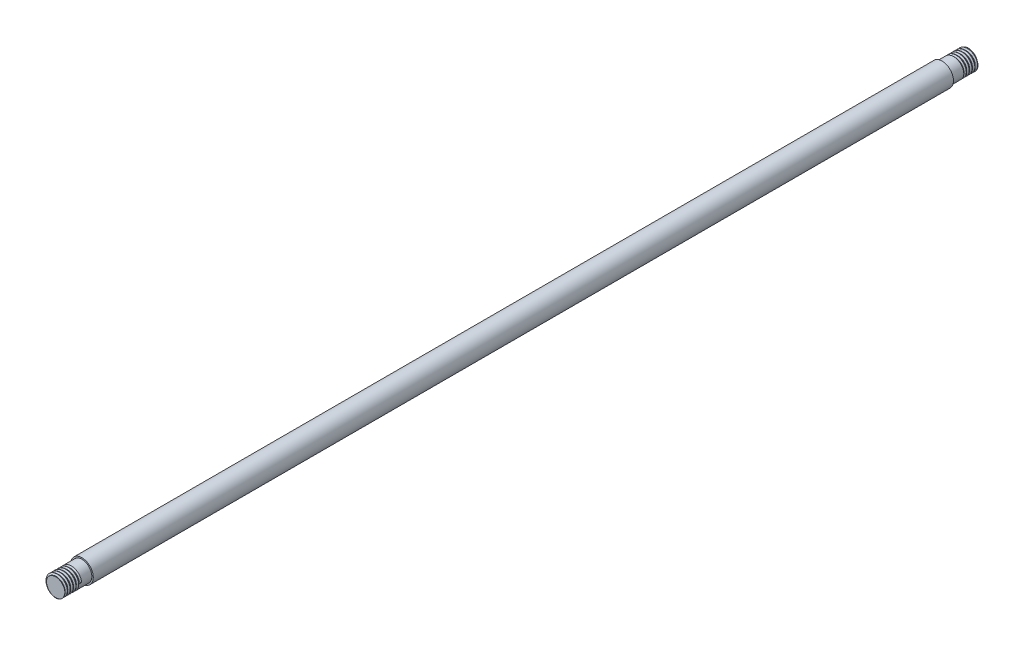
from build123d import *

# Parameters (mm, degrees)
THREAD1_PITCH = 2
THREAD2_PITCH = 2


with BuildPart() as part:
    # Sketch1 → Revolve8 (revolve)
    with BuildSketch(Plane(origin=(0, 0, 0), x_dir=(0, 0, -1), z_dir=(1, 0, 0)), mode=Mode.PRIVATE) as revolve8_sk:
        Polygon((-69.022947086, 0), (573.977052914, 0), (573.977052914, -7), (554.977052914, -7), (554.977052914, -8), (-50.022947086, -8), (-50.022947086, -7), (-69.022947086, -7), align=None)
    revolve(revolve8_sk.sketch.rotate(Axis((0, 0, 69.022947086), (0, 0, -1)), 270), axis=Axis((0, 0, 69.022947086), (0, 0, -1)))

    # Thread1: arcs per turn and ends read off the stored shape
    # Thread1: the profile of Thread Profile1 profile screwed along a right-hand helix through 6.5 turns, 10 arcs to a turn; built about Z, then put on its axis
    thread1_z = Axis((0, 0, 0), (0, 0, 1))
    thread1_corners = [(7.0003, 0, -0.000173205), (7.0003, 0, 1.7501732), (5.91746825, 0, 1.124999997), (5.91746825, 0, 0.624999997)]
    with BuildLine(mode=Mode.PRIVATE) as thread1_profile:
        Line(thread1_corners[0], thread1_corners[1])
        Line(thread1_corners[1], thread1_corners[2])
        Line(thread1_corners[2], thread1_corners[3])
        Line(thread1_corners[3], thread1_corners[0])
    thread1_cap = Face(thread1_profile.wire())
    thread1_turn_angles = [0, 18, 36, 54, 72, 90, 108, 126, 144, 162, 180, 198, 216, 234, 252, 270, 288, 306, 324, 342, 360]
    thread1_turn_weights = [1, 0.9510565162951535, 1, 0.9510565162951535, 1, 0.9510565162951535, 1, 0.9510565162951535, 1, 0.9510565162951535, 1, 0.9510565162951535, 1, 0.9510565162951535, 1, 0.9510565162951535, 1, 0.9510565162951535, 1, 0.9510565162951535, 1]
    thread1_turn_rails = [Edge.make_bspline([Vector(p[0], p[1], 0).rotate(thread1_z, thread1_turn_angles[k]) / thread1_turn_weights[k] + Vector(0, 0, p[2] + THREAD1_PITCH * thread1_turn_angles[k] / 360) for k in range(21)], [0, 0, 0, 1, 1, 2, 2, 3, 3, 4, 4, 5, 5, 6, 6, 7, 7, 8, 8, 9, 9, 10, 10, 10], 2, thread1_turn_weights) for p in thread1_corners]
    thread1_turn_sides = [Face.make_surface_from_curves(thread1_turn_rails[p[0]], thread1_turn_rails[p[1]]) for p in [(0, 1), (1, 2), (2, 3), (3, 0)]]
    thread1_last_angles = [2160, 2178, 2196, 2214, 2232, 2250, 2268, 2286, 2304, 2322, 2340]
    thread1_last_weights = [1, 0.9510565162951535, 1, 0.9510565162951535, 1, 0.9510565162951535, 1, 0.9510565162951535, 1, 0.9510565162951535, 1]
    thread1_last_rails = [Edge.make_bspline([Vector(p[0], p[1], 0).rotate(thread1_z, thread1_last_angles[k]) / thread1_last_weights[k] + Vector(0, 0, p[2] + THREAD1_PITCH * thread1_last_angles[k] / 360) for k in range(11)], [0, 0, 0, 1, 1, 2, 2, 3, 3, 4, 4, 5, 5, 5], 2, thread1_last_weights) for p in thread1_corners]
    thread1_last_sides = [Face.make_surface_from_curves(thread1_last_rails[p[0]], thread1_last_rails[p[1]]) for p in [(0, 1), (1, 2), (2, 3), (3, 0)]]
    thread1 = Plane(origin=(0, 0, 72.022947086), x_dir=(-1, 0, 0), z_dir=(0, 0, -1)) * Solid(Shell([*[p.moved(Location((0, 0, THREAD1_PITCH * i))) for i in range(6) for p in thread1_turn_sides], *thread1_last_sides, thread1_cap, thread1_cap.rotate(thread1_z, 2340).moved(Location((0, 0, THREAD1_PITCH * 2340 / 360)))]))
    add(thread1, mode=Mode.SUBTRACT)

    # Thread2: arcs per turn and ends read off the stored shape
    # Thread2: the profile of Thread Profile2 profile screwed along a right-hand helix through 6.5 turns, 10 arcs to a turn; built about Z, then put on its axis
    thread2_z = Axis((0, 0, 0), (0, 0, 1))
    thread2_corners = [(7.0003, 0, -0.000173205), (7.0003, 0, 1.7501732), (5.91746825, 0, 1.124999997), (5.91746825, 0, 0.624999997)]
    with BuildLine(mode=Mode.PRIVATE) as thread2_profile:
        Line(thread2_corners[0], thread2_corners[1])
        Line(thread2_corners[1], thread2_corners[2])
        Line(thread2_corners[2], thread2_corners[3])
        Line(thread2_corners[3], thread2_corners[0])
    thread2_cap = Face(thread2_profile.wire())
    thread2_turn_angles = [0, 18, 36, 54, 72, 90, 108, 126, 144, 162, 180, 198, 216, 234, 252, 270, 288, 306, 324, 342, 360]
    thread2_turn_weights = [1, 0.9510565162951535, 1, 0.9510565162951535, 1, 0.9510565162951535, 1, 0.9510565162951535, 1, 0.9510565162951535, 1, 0.9510565162951535, 1, 0.9510565162951535, 1, 0.9510565162951535, 1, 0.9510565162951535, 1, 0.9510565162951535, 1]
    thread2_turn_rails = [Edge.make_bspline([Vector(p[0], p[1], 0).rotate(thread2_z, thread2_turn_angles[k]) / thread2_turn_weights[k] + Vector(0, 0, p[2] + THREAD2_PITCH * thread2_turn_angles[k] / 360) for k in range(21)], [0, 0, 0, 1, 1, 2, 2, 3, 3, 4, 4, 5, 5, 6, 6, 7, 7, 8, 8, 9, 9, 10, 10, 10], 2, thread2_turn_weights) for p in thread2_corners]
    thread2_turn_sides = [Face.make_surface_from_curves(thread2_turn_rails[p[0]], thread2_turn_rails[p[1]]) for p in [(0, 1), (1, 2), (2, 3), (3, 0)]]
    thread2_last_angles = [2160, 2178, 2196, 2214, 2232, 2250, 2268, 2286, 2304, 2322, 2340]
    thread2_last_weights = [1, 0.9510565162951535, 1, 0.9510565162951535, 1, 0.9510565162951535, 1, 0.9510565162951535, 1, 0.9510565162951535, 1]
    thread2_last_rails = [Edge.make_bspline([Vector(p[0], p[1], 0).rotate(thread2_z, thread2_last_angles[k]) / thread2_last_weights[k] + Vector(0, 0, p[2] + THREAD2_PITCH * thread2_last_angles[k] / 360) for k in range(11)], [0, 0, 0, 1, 1, 2, 2, 3, 3, 4, 4, 5, 5, 5], 2, thread2_last_weights) for p in thread2_corners]
    thread2_last_sides = [Face.make_surface_from_curves(thread2_last_rails[p[0]], thread2_last_rails[p[1]]) for p in [(0, 1), (1, 2), (2, 3), (3, 0)]]
    thread2 = Plane(origin=(0, 0, -576.977052914), x_dir=(1, 0, 0), z_dir=(0, 0, 1)) * Solid(Shell([*[p.moved(Location((0, 0, THREAD2_PITCH * i))) for i in range(6) for p in thread2_turn_sides], *thread2_last_sides, thread2_cap, thread2_cap.rotate(thread2_z, 2340).moved(Location((0, 0, THREAD2_PITCH * 2340 / 360)))]))
    add(thread2, mode=Mode.SUBTRACT)


solid = part.part
